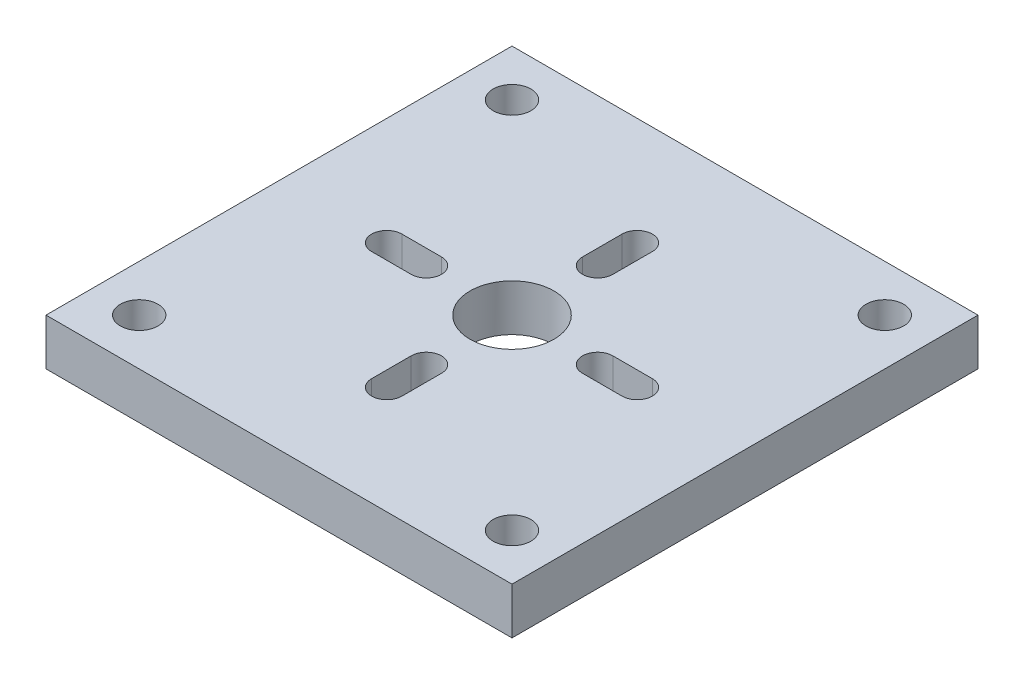
from build123d import *

# Parameters (mm, degrees)
SKETCH1_W          = 100
SKETCH1_H          = 100
BASE_DEPTH         = 10
SKETCH2_R          = 9
ACTUATOR_CUT_DEPTH = 40
CUT_EXTRUDE1_REACH = 73.414
CUT_EXTRUDE2_REACH = 73.414
SKETCH5_R          = 4.05


with BuildPart() as part:
    # Sketch1 → base (new body)
    with BuildSketch(Plane(origin=(0, 0, 0), x_dir=(1, 0, 0), z_dir=(0, 1, 0))):
        Rectangle(SKETCH1_W, SKETCH1_H)
    extrude(amount=BASE_DEPTH)

    # Sketch2 → actuator cut (cut)
    with BuildSketch(Plane(origin=(0, 10, 0), x_dir=(1, 0, 0), z_dir=(0, 1, 0))):
        Circle(SKETCH2_R)
    extrude(amount=-ACTUATOR_CUT_DEPTH, mode=Mode.SUBTRACT)

    # Sketch3 → Cut-Extrude1 (cut, up to next)
    with BuildSketch(Plane(origin=(0, 10, 0), x_dir=(1, 0, 0), z_dir=(0, 1, 0)), mode=Mode.PRIVATE) as cut_extrude1_sk1:
        with BuildLine():
            Line((3.25, -26.870057685), (3.25, -18.384776311))
            ThreePointArc((3.25, -18.384776311), (0, -15.134776311), (-3.25, -18.384776311))
            Line((-3.25, -18.384776311), (-3.25, -26.870057685))
            ThreePointArc((-3.25, -26.870057685), (0, -30.120057685), (3.25, -26.870057685))
        make_face()
    cut_extrude1_tool1 = extrude(cut_extrude1_sk1.sketch, amount=-CUT_EXTRUDE1_REACH, mode=Mode.PRIVATE) & part.part
    # Sketch3 → Cut-Extrude1 (cut, up to next)
    with BuildSketch(Plane(origin=(0, 10, 0), x_dir=(1, 0, 0), z_dir=(0, 1, 0)), mode=Mode.PRIVATE) as cut_extrude1_sk2:
        with BuildLine():
            Line((26.870057685, 3.25), (18.384776311, 3.25))
            ThreePointArc((18.384776311, 3.25), (15.134776311, 0), (18.384776311, -3.25))
            Line((18.384776311, -3.25), (26.870057685, -3.25))
            ThreePointArc((26.870057685, -3.25), (30.120057685, 0), (26.870057685, 3.25))
        make_face()
    cut_extrude1_tool2 = extrude(cut_extrude1_sk2.sketch, amount=-CUT_EXTRUDE1_REACH, mode=Mode.PRIVATE) & part.part
    # Sketch3 → Cut-Extrude1 (cut, up to next)
    with BuildSketch(Plane(origin=(0, 10, 0), x_dir=(1, 0, 0), z_dir=(0, 1, 0)), mode=Mode.PRIVATE) as cut_extrude1_sk3:
        with BuildLine():
            Line((-26.870057685, -3.25), (-18.384776311, -3.25))
            ThreePointArc((-18.384776311, -3.25), (-15.134776311, 0), (-18.384776311, 3.25))
            Line((-18.384776311, 3.25), (-26.870057685, 3.25))
            ThreePointArc((-26.870057685, 3.25), (-30.120057685, 0), (-26.870057685, -3.25))
        make_face()
    cut_extrude1_tool3 = extrude(cut_extrude1_sk3.sketch, amount=-CUT_EXTRUDE1_REACH, mode=Mode.PRIVATE) & part.part
    # Sketch3 → Cut-Extrude1 (cut, up to next)
    with BuildSketch(Plane(origin=(0, 10, 0), x_dir=(1, 0, 0), z_dir=(0, 1, 0)), mode=Mode.PRIVATE) as cut_extrude1_sk4:
        with BuildLine():
            Line((-3.25, 26.870057685), (-3.25, 18.384776311))
            ThreePointArc((-3.25, 18.384776311), (0, 15.134776311), (3.25, 18.384776311))
            Line((3.25, 18.384776311), (3.25, 26.870057685))
            ThreePointArc((3.25, 26.870057685), (0, 30.120057685), (-3.25, 26.870057685))
        make_face()
    cut_extrude1_tool4 = extrude(cut_extrude1_sk4.sketch, amount=-CUT_EXTRUDE1_REACH, mode=Mode.PRIVATE) & part.part
    add(cut_extrude1_tool1.solids().sort_by_distance((0, 10, 22.627417))[0], mode=Mode.SUBTRACT)
    add(cut_extrude1_tool2.solids().sort_by_distance((22.627417, 10, 0))[0], mode=Mode.SUBTRACT)
    add(cut_extrude1_tool3.solids().sort_by_distance((-22.627417, 10, 0))[0], mode=Mode.SUBTRACT)
    add(cut_extrude1_tool4.solids().sort_by_distance((0, 10, -22.627417))[0], mode=Mode.SUBTRACT)

    # Sketch5 → Cut-Extrude2 (cut, up to next)
    with BuildSketch(Plane(origin=(0, 10, 0), x_dir=(1, 0, 0), z_dir=(0, 1, 0)), mode=Mode.PRIVATE) as cut_extrude2_sk1:
        with Locations((-40, -40)):
            Circle(SKETCH5_R)
    cut_extrude2_tool1 = extrude(cut_extrude2_sk1.sketch, amount=-CUT_EXTRUDE2_REACH, mode=Mode.PRIVATE) & part.part
    # Sketch5 → Cut-Extrude2 (cut, up to next)
    with BuildSketch(Plane(origin=(0, 10, 0), x_dir=(1, 0, 0), z_dir=(0, 1, 0)), mode=Mode.PRIVATE) as cut_extrude2_sk2:
        with Locations((-40, 40)):
            Circle(SKETCH5_R)
    cut_extrude2_tool2 = extrude(cut_extrude2_sk2.sketch, amount=-CUT_EXTRUDE2_REACH, mode=Mode.PRIVATE) & part.part
    # Sketch5 → Cut-Extrude2 (cut, up to next)
    with BuildSketch(Plane(origin=(0, 10, 0), x_dir=(1, 0, 0), z_dir=(0, 1, 0)), mode=Mode.PRIVATE) as cut_extrude2_sk3:
        with Locations((40, -40)):
            Circle(SKETCH5_R)
    cut_extrude2_tool3 = extrude(cut_extrude2_sk3.sketch, amount=-CUT_EXTRUDE2_REACH, mode=Mode.PRIVATE) & part.part
    # Sketch5 → Cut-Extrude2 (cut, up to next)
    with BuildSketch(Plane(origin=(0, 10, 0), x_dir=(1, 0, 0), z_dir=(0, 1, 0)), mode=Mode.PRIVATE) as cut_extrude2_sk4:
        with Locations((40, 40)):
            Circle(SKETCH5_R)
    cut_extrude2_tool4 = extrude(cut_extrude2_sk4.sketch, amount=-CUT_EXTRUDE2_REACH, mode=Mode.PRIVATE) & part.part
    add(cut_extrude2_tool1.solids().sort_by_distance((-40, 10, 40))[0], mode=Mode.SUBTRACT)
    add(cut_extrude2_tool2.solids().sort_by_distance((-40, 10, -40))[0], mode=Mode.SUBTRACT)
    add(cut_extrude2_tool3.solids().sort_by_distance((40, 10, 40))[0], mode=Mode.SUBTRACT)
    add(cut_extrude2_tool4.solids().sort_by_distance((40, 10, -40))[0], mode=Mode.SUBTRACT)


solid = part.part
